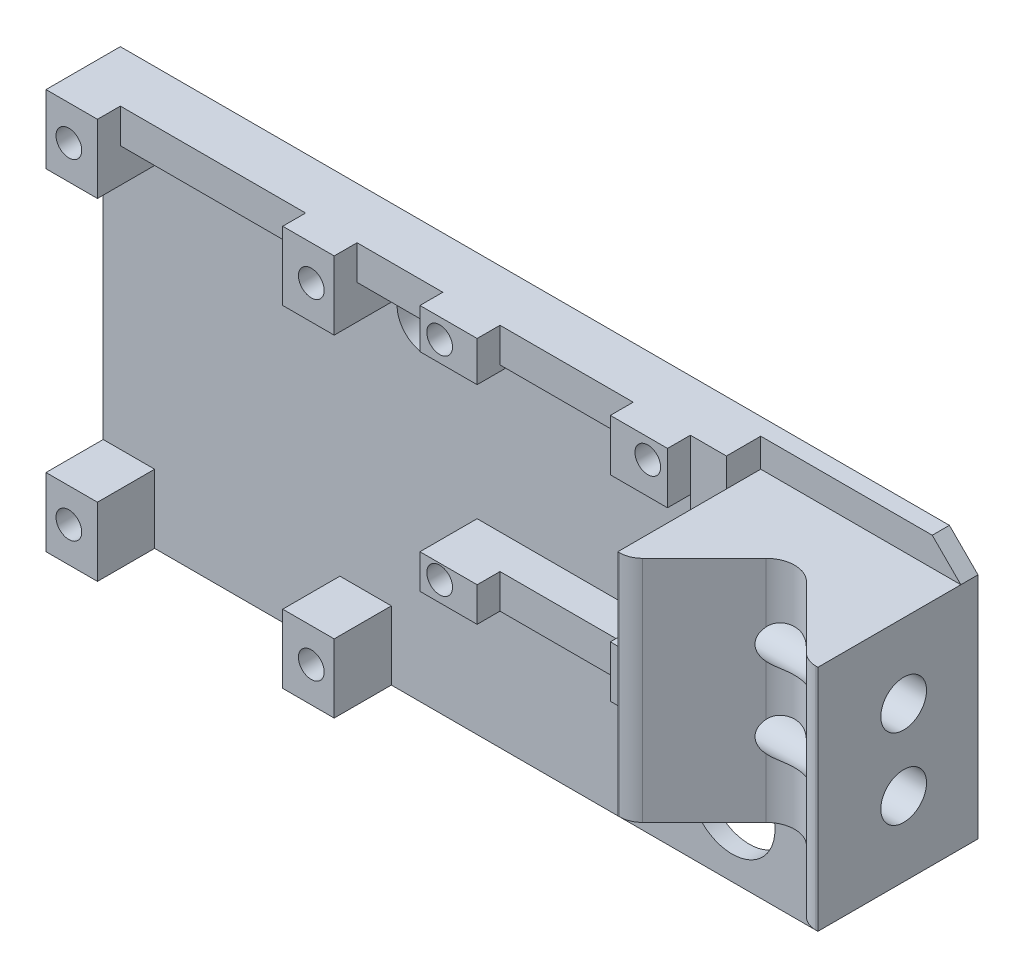
from build123d import *

# Parameters (mm, degrees)
ESQUISSE1_W               = 150
ESQUISSE1_H               = 70
BOSS_EXTRU_1_DEPTH        = 3
ESQUISSE2_W               = 9
ESQUISSE2_H               = 12
ESQUISSE2_R               = 2.25
BOSS_EXTRU_2_DEPTH        = 10
SYM_TRIE2_COPY_1_SKETCH_W = 9
SYM_TRIE2_COPY_1_SKETCH_H = 12
SYM_TRIE2_COPY_1_SKETCH_R = 2.25
SYM_TRIE2_COPY_1_DEPTH    = 10
ESQUISSE3_W               = 10
ESQUISSE3_H               = 6
ESQUISSE3_R               = 2.25
BOSS_EXTRU_3_DEPTH        = 10
SYM_TRIE4_COPY_1_SKETCH_W = 10
SYM_TRIE4_COPY_1_SKETCH_H = 6
SYM_TRIE4_COPY_1_SKETCH_R = 2.25
SYM_TRIE4_COPY_1_DEPTH    = 10
BOSS_EXTRU_4_DEPTH        = 10
BOSS_EXTRU_4_DEPTH_BACK   = 30
CONG_1_R                  = 5
CONG_2_R                  = 4
ENL_V_MAT_EXTRU_1_REACH   = 169.881
ESQUISSE5_R               = 4
ESQUISSE6_W               = 23.3
ESQUISSE6_H               = 6
ESQUISSE6_W_2             = 6.3
ESQUISSE6_H_2             = 45
BOSS_EXTRU_5_DEPTH        = 6
CHANFREIN1_SIZE           = 1.7
ESQUISSE7_W               = 15
ESQUISSE7_H               = 6
ESQUISSE7_W_2             = 32.4
BOSS_EXTRU_6_DEPTH        = 6
CHANFREIN2_SIZE           = 5
CHANFREIN3_SIZE           = 25
ESQUISSE8_R               = 5
ENL_V_MAT_EXTRU_2_DEPTH   = 168.406690517
ESQUISSE9_R               = 7.5
ENL_V_MAT_EXTRU_3_DEPTH   = 168.406690517
ESQUISSE10_W              = 10
ESQUISSE10_H              = 1
ESQUISSE10_H_2            = 3
BOSS_EXTRU_7_DEPTH        = 10


with BuildPart() as part:
    # Esquisse1 → Boss.-Extru.1 (new body)
    with BuildSketch(Plane.XY):
        with Locations((75, 35)):
            Rectangle(ESQUISSE1_W, ESQUISSE1_H)
    extrude(amount=BOSS_EXTRU_1_DEPTH)

    # Esquisse2 → Boss.-Extru.2 (add)
    with BuildSketch(Plane.XY.offset(3)):
        with Locations((4.5, 64)):
            Rectangle(ESQUISSE2_W, ESQUISSE2_H)
        with Locations((4, 63.9)):
            Circle(ESQUISSE2_R, mode=Mode.SUBTRACT)
    boss_extru_2 = extrude(amount=BOSS_EXTRU_2_DEPTH)

    # Symétrie1: Boss.-Extru.2 across plane
    add(boss_extru_2.mirror(Plane.ZY.offset(-25.2)))

    # Symétrie2: Boss.-Extru.2 across plane
    add(boss_extru_2.mirror(Plane(origin=(0, 35, 0), x_dir=(0, 0, 1), z_dir=(0, -1, 0))))

    # Symétrie2 copy 1 sketch → Symétrie2 copy 1 (add)
    with BuildSketch(Plane(origin=(50.4, 70, 3), x_dir=(-1, 0, 0), z_dir=(0, 0, 1))):
        with Locations((4.5, 64)):
            Rectangle(SYM_TRIE2_COPY_1_SKETCH_W, SYM_TRIE2_COPY_1_SKETCH_H)
        with Locations((4, 63.9)):
            Circle(SYM_TRIE2_COPY_1_SKETCH_R, mode=Mode.SUBTRACT)
    extrude(amount=SYM_TRIE2_COPY_1_DEPTH)

    # Esquisse3 → Boss.-Extru.3 (add)
    with BuildSketch(Plane.XY.offset(3)):
        with Locations((70.4, 67)):
            Rectangle(ESQUISSE3_W, ESQUISSE3_H)
        with Locations((68.85, 66.55)):
            Circle(ESQUISSE3_R, mode=Mode.SUBTRACT)
    boss_extru_3 = extrude(amount=BOSS_EXTRU_3_DEPTH)

    # Symétrie3: Boss.-Extru.3 across plane
    add(boss_extru_3.mirror(Plane.ZY.offset(-87.05)))

    # Symétrie4: Boss.-Extru.3 across plane
    add(boss_extru_3.mirror(Plane.ZX.offset(48.35)))

    # Symétrie4 copy 1 sketch → Symétrie4 copy 1 (add)
    with BuildSketch(Plane(origin=(174.1, 96.7, 3), x_dir=(-1, 0, 0), z_dir=(0, 0, 1))):
        with Locations((70.4, 67)):
            Rectangle(SYM_TRIE4_COPY_1_SKETCH_W, SYM_TRIE4_COPY_1_SKETCH_H)
        with Locations((68.85, 66.55)):
            Circle(SYM_TRIE4_COPY_1_SKETCH_R, mode=Mode.SUBTRACT)
    extrude(amount=SYM_TRIE4_COPY_1_DEPTH)

    # Esquisse4 → Boss.-Extru.4 (add, two sides: drawn at the far end of the back side and taken through both)
    with BuildSketch(Plane(origin=(0, 35, 0), x_dir=(-1, 0, 0), z_dir=(0, -1, 0)).offset(-BOSS_EXTRU_4_DEPTH_BACK)):
        Polygon((-150, -3), (-150, -28), (-148, -28), (-132.5, -12.5), (-117, -28), (-115, -28), (-115, -3), align=None)
    extrude(amount=BOSS_EXTRU_4_DEPTH + BOSS_EXTRU_4_DEPTH_BACK)

    # Congé1
    cong_1_edges = [part.edges().sort_by_distance(p)[0] for p in [
        (132.5, 45, 12.5),
    ]]
    fillet(cong_1_edges, radius=CONG_1_R)

    # Congé2
    cong_2_edges = [part.edges().sort_by_distance(p)[0] for p in [
        (117, 45, 28),
        (148, 45, 28),
    ]]
    fillet(cong_2_edges, radius=CONG_2_R)

    # Enlèv. mat.-Extru.1: up to this face of the body (flat: up to its plane)
    enl_v_mat_extru_1_end = Plane(part.part.faces().sort_by_distance((115, 45, 15.5))[0])
    # Esquisse5 → Enlèv. mat.-Extru.1 (cut, up to the picked face)
    with BuildSketch(Plane(origin=(150, 0, 0), x_dir=(0, 0, -1), z_dir=(1, 0, 0)), mode=Mode.PRIVATE) as enl_v_mat_extru_1_sk1:
        with Locations((-13, 52)):
            Circle(ESQUISSE5_R)
    enl_v_mat_extru_1_tool1 = split(extrude(enl_v_mat_extru_1_sk1.sketch, amount=-ENL_V_MAT_EXTRU_1_REACH, mode=Mode.PRIVATE), bisect_by=enl_v_mat_extru_1_end, keep=Keep.BOTH, mode=Mode.PRIVATE)
    # Esquisse5 → Enlèv. mat.-Extru.1 (cut, up to the picked face)
    with BuildSketch(Plane(origin=(150, 0, 0), x_dir=(0, 0, -1), z_dir=(1, 0, 0)), mode=Mode.PRIVATE) as enl_v_mat_extru_1_sk2:
        with Locations((-13, 38)):
            Circle(ESQUISSE5_R)
    enl_v_mat_extru_1_tool2 = split(extrude(enl_v_mat_extru_1_sk2.sketch, amount=-ENL_V_MAT_EXTRU_1_REACH, mode=Mode.PRIVATE), bisect_by=enl_v_mat_extru_1_end, keep=Keep.BOTH, mode=Mode.PRIVATE)
    add(enl_v_mat_extru_1_tool1.solids().sort_by(Axis((150, 52, 13), (-1, 0, 0)))[0], mode=Mode.SUBTRACT)
    add(enl_v_mat_extru_1_tool2.solids().sort_by(Axis((150, 38, 13), (-1, 0, 0)))[0], mode=Mode.SUBTRACT)

    # Esquisse6 → Boss.-Extru.5 (add)
    with BuildSketch(Plane.XY.offset(3)):
        with Locations((87.05, 67)):
            Rectangle(ESQUISSE6_W, ESQUISSE6_H)
        with Locations((87.05, 29.7)):
            Rectangle(ESQUISSE6_W, ESQUISSE6_H)
        with Locations((111.85, 47.5)):
            Rectangle(ESQUISSE6_W_2, ESQUISSE6_H_2)
    extrude(amount=BOSS_EXTRU_5_DEPTH)

    # Chanfrein1
    chanfrein1_edges = [part.edges().sort_by_distance(p)[0] for p in [
        (108.7, 25, 6),
    ]]
    chamfer(chanfrein1_edges, length=CHANFREIN1_SIZE - 0.0001)  # a hair under: the kernel refuses the full size

    # Esquisse7 → Boss.-Extru.6 (add)
    with BuildSketch(Plane.XY.offset(3)):
        with Locations((57.9, 67)):
            Rectangle(ESQUISSE7_W, ESQUISSE7_H)
        with Locations((25.2, 67)):
            Rectangle(ESQUISSE7_W_2, ESQUISSE7_H)
    extrude(amount=BOSS_EXTRU_6_DEPTH)

    # Chanfrein2
    chanfrein2_edges = [part.edges().sort_by_distance(p)[0] for p in [
        (150, 70, 1.5),
    ]]
    chamfer(chanfrein2_edges, length=CHANFREIN2_SIZE)

    # Chanfrein3
    chanfrein3_edges = [part.edges().sort_by_distance(p)[0] for p in [
        (150, 0, 1.5),
    ]]
    chamfer(chanfrein3_edges, length=CHANFREIN3_SIZE)

    # Esquisse8 → Enlèv. mat.-Extru.2 (cut, through all)
    with BuildSketch(Plane.XY.offset(3)):
        with Locations((56.4, 58)):
            Circle(ESQUISSE8_R)
    extrude(amount=-ENL_V_MAT_EXTRU_2_DEPTH, mode=Mode.SUBTRACT)

    # Esquisse9 → Enlèv. mat.-Extru.3 (cut, through all)
    with BuildSketch(Plane.XY.offset(3)):
        with Locations((110, 11.7)):
            Circle(ESQUISSE9_R)
    extrude(amount=-ENL_V_MAT_EXTRU_3_DEPTH, mode=Mode.SUBTRACT)

    # Esquisse10 → Boss.-Extru.7 (add)
    with BuildSketch(Plane.XY.offset(3)):
        with Locations((70.4, 63.5)):
            Rectangle(ESQUISSE10_W, ESQUISSE10_H)
        with Locations((103.7, 62.5)):
            Rectangle(ESQUISSE10_W, ESQUISSE10_H_2)
        with Locations((103.7, 34.2)):
            Rectangle(ESQUISSE10_W, ESQUISSE10_H_2)
    extrude(amount=BOSS_EXTRU_7_DEPTH)


solid = part.part
